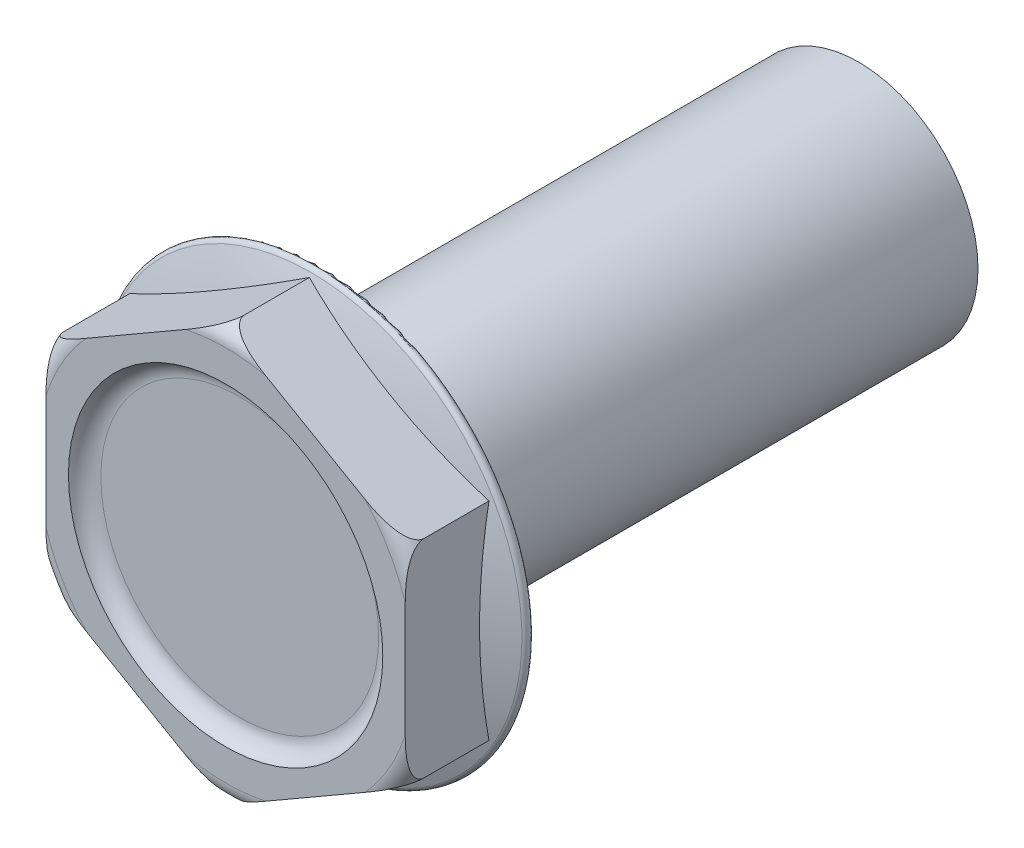
from build123d import *

# Parameters (mm, degrees)
HEAD_DEPTH     = 10
SHANK_SKETCH_R = 12.7
SHANK_DEPTH    = 57.15
SKETCH6_R      = 16.66875
HEAD_CUT_DEPTH = 1.5
FILLET1_R      = 2
FILLET2_R      = 0.5
THREAD_END_W   = 50.8
THREAD_END_H   = 0.05


with BuildPart() as part:
    # Head Sketch → Head (new body)
    with BuildSketch(Plane.XY):
        Polygon((0, 21.997045256), (19.05, 10.998522628), (19.05, -10.998522628), (0, -21.997045256), (-19.05, -10.998522628), (-19.05, 10.998522628), align=None)
    extrude(amount=HEAD_DEPTH)

    # Shank Sketch → Shank (add)
    with BuildSketch(Plane.XY):
        Circle(SHANK_SKETCH_R)
    extrude(amount=-SHANK_DEPTH)

    # Sketch3 → Flange (revolve)
    with BuildSketch(Plane(origin=(0, 0, 0), x_dir=(-1, 0, 0), z_dir=(0, 1, 0)), mode=Mode.PRIVATE) as flange_sk:
        with BuildLine():
            Line((-22.225, 0), (0, 0))
            Line((0, 0), (0, 5))
            ThreePointArc((0, 5), (-11.379608963, 3.984124175), (-22.399330603, 0.968624413))
            ThreePointArc((-22.399330603, 0.968624413), (-22.717093592, 0.411434224), (-22.225, 0))
        make_face()
    revolve(flange_sk.sketch.rotate(Axis((0, 0, 0), (0, 0, 1)), 30), axis=Axis((0, 0, 0), (0, 0, 1)))

    # Sketch5 → Head Trim (revolve, cut)
    with BuildSketch(Plane(origin=(0, 0, 0), x_dir=(0, 0, -1), z_dir=(1, 0, 0)), mode=Mode.PRIVATE) as head_trim_sk:
        with BuildLine():
            Line((-10, -19.997045256), (-10, -21.997045256))
            Line((-10, -21.997045256), (-8, -21.997045256))
            ThreePointArc((-8, -21.997045256), (-9.414213562, -21.411258818), (-10, -19.997045256))
        make_face()
    revolve(head_trim_sk.sketch.rotate(Axis((0, 0, 15.085599173), (0, 0, -1)), 90), axis=Axis((0, 0, 15.085599173), (0, 0, -1)), mode=Mode.SUBTRACT)

    # Sketch6 → Head Cut (cut)
    with BuildSketch(Plane.XY.offset(10)):
        Circle(SKETCH6_R)
    extrude(amount=-HEAD_CUT_DEPTH, mode=Mode.SUBTRACT)

    # Fillet1
    # the kernel refuses this fillet: 2 mm, written as the material it adds along each edge
    with BuildSketch(Plane(origin=(0, 0, 8.5), x_dir=(1, 0, 0), z_dir=(0, -1, 0))) as fillet1_piece_1:
        with BuildLine():
            CenterArc((14.732258327, 2), FILLET1_R, 270, 75.522487814)
            Line((14.732258327, 0), (14.732258327, -0.04))
            Line((14.732258327, -0.04), (16.66875, -0.04))
            Line((16.66875, -0.04), (16.70875, 0))
            ThreePointArc((16.70875, 0), (16.70875, 0.75), (16.707479833, 1.49))
            Line((16.707479833, 1.49), (16.66875, 1.5))
        make_face()
    revolve(axis=Axis((0, 0, 8.5), (0, 0, 1)))

    # Fillet2
    fillet2_edges = [part.edges().sort_by_distance(p)[0] for p in [
        (-12.7, 0, 0),
    ]]
    fillet(fillet2_edges, radius=FILLET2_R)

    # Thread End → Thread Cut (revolve, cut)
    with BuildSketch(Plane(origin=(0, 0, 0), x_dir=(0, 0, -1), z_dir=(1, 0, 0)), mode=Mode.PRIVATE) as thread_cut_sk:
        with Locations((31.75, 12.675)):
            Rectangle(THREAD_END_W, THREAD_END_H)
    revolve(thread_cut_sk.sketch.rotate(Axis((0, 0, -21.551935625), (0, 0, -1)), 90), axis=Axis((0, 0, -21.551935625), (0, 0, -1)), mode=Mode.SUBTRACT)


solid = part.part
